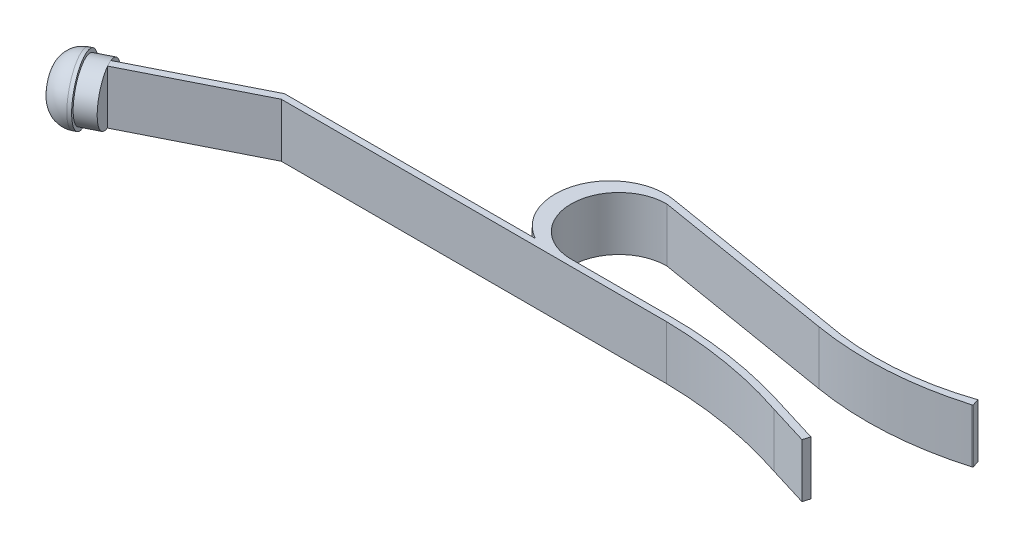
from build123d import *

# Parameters (mm, degrees)
BOSS_EXTRUDE1_DEPTH = 15
SKETCH2_R           = 7.490706033
BOSS_EXTRUDE2_DEPTH = 5
SKETCH3_R           = 8.44094948
BOSS_EXTRUDE3_DEPTH = 7
FILLET1_R           = 1


with BuildPart() as part:
    # Sketch1 → Boss-Extrude1 (new body)
    with BuildSketch(Plane(origin=(0, 0, 0), x_dir=(1, 0, 0), z_dir=(0, 1, 0))):
        with BuildLine():
            Line((-17.967290282, 0), (-45.431439127, 0))
            ThreePointArc((-45.431439127, 0), (-58.787226235, 13.355787108), (-45.431439127, 26.711574216))
            Line((-45.431439127, 26.711574216), (5.45092281, 18.253380544))
            ThreePointArc((5.45092281, 18.253380544), (25.659892843, 17.20031813), (45.593289448, 20.689029929))
            Line((45.593289448, 20.689029929), (45.940338636, 20.791055963))
            Line((45.940338636, 20.791055963), (45.352375673, 22.791055963))
            ThreePointArc((45.352375673, 22.791055963), (25.570805515, 18.868293737), (5.45092281, 20.242666786))
            Line((5.45092281, 20.242666786), (-45.495890395, 28.711574216))
            ThreePointArc((-45.495890395, 28.711574216), (-62.583598174, 18.547920568), (-55.423692083, 0))
            Line((-55.423692083, 0), (-125.431439127, 0))
            Line((-125.431439127, 0), (-157.707883989, -16.232049306))
            Line((-157.707883989, -16.232049306), (-156.809303927, -18.01882122))
            Line((-156.809303927, -18.01882122), (-124.532859065, -1.786771914))
            Line((-124.532859065, -1.786771914), (-17.068710221, -1.786771914))
            ThreePointArc((-17.068710221, -1.786771914), (1.299435065, -3.480980646), (19.190909572, -7.970328534))
            Line((19.190909572, -7.970328534), (30.410309542, -11.40707822))
            Line((30.410309542, -11.40707822), (30.996087081, -9.494785179))
            Line((30.996087081, -9.494785179), (17.179362085, -5.262417546))
            ThreePointArc((17.179362085, -5.262417546), (-0.198073846, -1.322896281), (-17.967290282, 0))
        make_face()
    extrude(amount=BOSS_EXTRUDE1_DEPTH)

    # Sketch2 → Boss-Extrude2 (add)
    with BuildSketch(Plane(origin=(-132.388101561, 0, 66.578899913), x_dir=(0.4492900307338926, 0, 0.8933859570662267), z_dir=(-0.8933859570662267, 0, 0.4492900307338926))):
        with Locations(Location((-55.356167213, 7.508040546, 0), (0, 0, 97.663545488))):
            Circle(SKETCH2_R)
    extrude(amount=BOSS_EXTRUDE2_DEPTH)

    # Sketch3 → Boss-Extrude3 (add)
    with BuildSketch(Plane(origin=(-136.855031347, 0, 68.825350067), x_dir=(0.4492900307338926, 0, 0.8933859570662267), z_dir=(-0.8933859570662267, 0, 0.4492900307338926))):
        with Locations((-55.356167213, 7.508040546)):
            Circle(SKETCH3_R)
    extrude(amount=BOSS_EXTRUDE3_DEPTH)

    # Fillet1
    fillet1_edges = [part.edges().sort_by_distance(p)[0] for p in [
        (-171.772141566, 7.508040546, 14.974932127),
    ]]
    fillet(fillet1_edges, radius=FILLET1_R)

    # Fillet3: read off the stored shape, not the designer's step
    # Fillet3 outline → Fillet3 (revolve, cut)
    with BuildSketch(Plane(origin=(-24.870974068, 7.508040546, -49.454422425), x_dir=(0.4492900307338924, 0, 0.8933859570662267), z_dir=(0, 1, 0))):
        with BuildLine():
            Line((8.44094948, -159.186906806), (8.44094948, -154.186906806))
            ThreePointArc((8.44094948, -154.186906806), (6.683590167, -158.429547493), (2.44094948, -160.186906806))
            Line((2.44094948, -160.186906806), (7.44094948, -160.186906806))
            ThreePointArc((7.44094948, -160.186906806), (8.148056261, -159.894013587), (8.44094948, -159.186906806))
        make_face()
    revolve(axis=Axis((-24.870974068, 7.508040546, -49.454422425), (0.8933859570662267, 0, -0.4492900307338924)), mode=Mode.SUBTRACT)


solid = part.part
